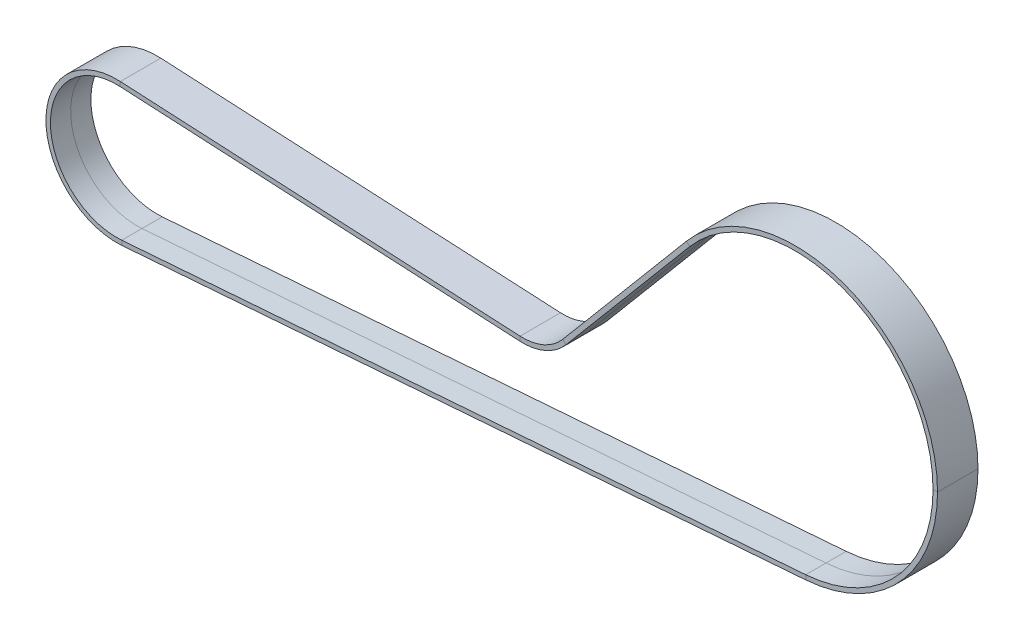
from build123d import *


with BuildPart() as part:
    # Sweep1: sweep along a path in Sketch2
    with BuildLine(Plane.XY) as sweep1_path:
        Line((4.069339119, -32.166085282), (-148.03091533, -43.797416737))
        ThreePointArc((-148.03091533, -43.797416737), (-165.62095268, -27.702158412), (-148.434405575, -11.176743043))
        Line((-148.434405575, -11.176743043), (-59.544929177, -15.766256816))
        ThreePointArc((-59.544929177, -15.766256816), (-54.596990441, -14.870937572), (-50.56443546, -11.867240746))
        Line((-50.56443546, -11.867240746), (-23.0643653, 20.782335159))
        ThreePointArc((-23.0643653, 20.782335159), (30.319317267, 14.712474999), (4.069339119, -32.166085282))
    # Sketch3 → Sweep1 (sweep)
    with BuildSketch(Plane(origin=(0, 0, 0), x_dir=(1, 0, 0), z_dir=(0, 1, 0))):
        Polygon((32.26, 0), (32.26, -4.5), (33.26, -4.5), (33.26, 4.5), (32.26, 4.5), align=None)
    sweep(path=sweep1_path.line)


solid = part.part
